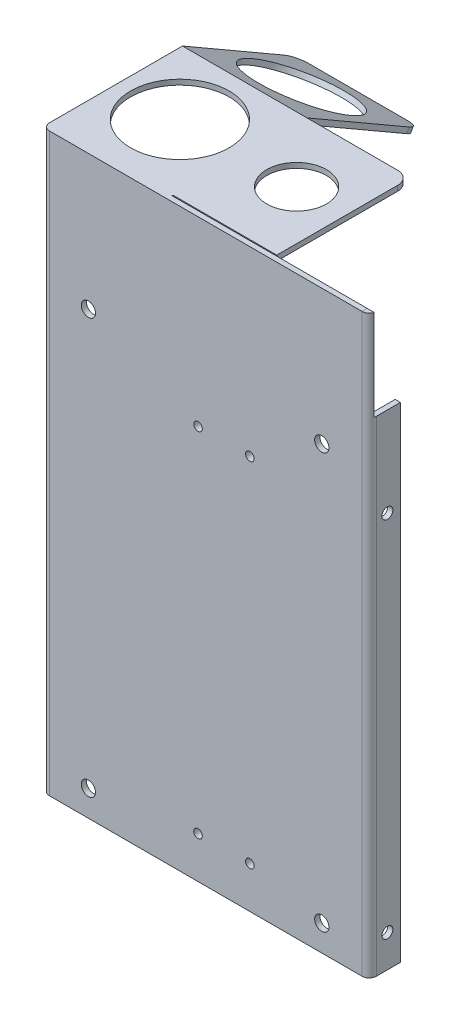
from build123d import *

# Parameters (mm, degrees)
SM_BASE_FLANGE_1_DEPTH = 111
CUT_EXTRUDE_1_REACH    = 170.348
SKETCH_3_W             = 10
SKETCH_3_H             = 35
EXTRUDE_1_DEPTH        = 4
M4X0_7_1_D             = 3.3
SKETCH_8_R             = 2.75
CUT_EXTRUDE_2_DEPTH    = 129.023435355
M5X0_8_1_AT_2_COUNT    = 2
M5X0_8_1_AT_2_PITCH    = 140
EXTRUDE_2_DEPTH        = 48
SKETCH_12_R            = 19
CUT_EXTRUDE_3_DEPTH    = 2
SKETCH_13_R            = 19
CUT_EXTRUDE_4_DEPTH    = 2
FILLET_1_R             = 5
SKETCH_14_W            = 51.6317
SKETCH_14_H            = 2
EXTRUDE_3_DEPTH        = 40
CUT_EXTRUDE_5_REACH    = 252.621
SKETCH_15_R            = 11.5
FILLET_2_R             = 5


# Sheet-metal steps are written as plain solids
with BuildPart() as part:
    # Sketch 1 → 基体-法兰1 (new, symmetric)
    with BuildSketch(Plane(origin=(0, 0, 0), x_dir=(1, 0, 0), z_dir=(0, 1, 0))):
        with BuildLine():
            Line((-63, 12), (-63, 2.7366))
            ThreePointArc((-63, 2.7366), (-62.198468417, 0.801531583), (-60.2634, 0))
            Line((-60.2634, 0), (60.2634, 0))
            ThreePointArc((60.2634, 0), (62.198468417, 0.801531583), (63, 2.7366))
            Line((63, 2.7366), (63, 12))
            Line((63, 12), (61, 12))
            Line((61, 12), (61, 2.7366))
            ThreePointArc((61, 2.7366), (60.784254855, 2.215745145), (60.2634, 2))
            Line((60.2634, 2), (-60.2634, 2))
            ThreePointArc((-60.2634, 2), (-60.784254855, 2.215745145), (-61, 2.7366))
            Line((-61, 2.7366), (-61, 12))
            Line((-61, 12), (-63, 12))
        make_face()
    extrude(amount=SM_BASE_FLANGE_1_DEPTH, both=True)

    # 草图3 → 切除-拉伸1 (cut, up to next)
    with BuildSketch(Plane(origin=(63, 0, 0), x_dir=(0, 0, -1), z_dir=(1, 0, 0)), mode=Mode.PRIVATE) as cut_extrude_1_sk1:
        with Locations((7, 93.5)):
            Rectangle(SKETCH_3_W, SKETCH_3_H)
    cut_extrude_1_tool1 = extrude(cut_extrude_1_sk1.sketch, amount=-CUT_EXTRUDE_1_REACH, mode=Mode.PRIVATE) & part.part
    add(cut_extrude_1_tool1.solids().sort_by_distance((63, 93.5, -7))[0], mode=Mode.SUBTRACT)

    # 草图4 → 凸台-拉伸1 (add)
    with BuildSketch(Plane(origin=(0, 0, -2), x_dir=(-1, 0, 0), z_dir=(0, 0, -1))):
        Polygon((-14.987954458, 43.07002562), (-17.786672003, 43.777495363), (-19.798717545, 41.707469743), (-19.012045542, 38.92997438), (-16.213327997, 38.222504637), (-14.201282455, 40.292530257), align=None)
        Polygon((5.723956961, 41.955715338), (3.534304719, 43.836873596), (0.810347758, 42.881158258), (0.276043039, 40.044284662), (2.465695281, 38.163126404), (5.189652242, 39.118841742), align=None)
        Polygon((-15.276915043, -92.683901651), (-18.14425753, -92.34971548), (-19.867342487, -94.665813829), (-18.723084957, -97.316098349), (-15.85574247, -97.65028452), (-14.132657513, -95.334186171), align=None)
        Polygon((5.052579277, -92.9701597), (2.268396373, -92.207494053), (0.215817096, -94.237334353), (0.947420723, -97.0298403), (3.731603627, -97.792505947), (5.784182904, -95.762665647), align=None)
    extrude(amount=EXTRUDE_1_DEPTH)

    # M4x0.7 螺纹孔1 (through all)
    with Locations(Plane(origin=(0, 0, -6), x_dir=(-1, 0, 0), z_dir=(0, 0, -1))):
        with Locations((-17, 41), (3, 41), (-17, -95), (3, -95)):
            Hole(M4X0_7_1_D / 2)

    # 草图8 → 切除-拉伸2 (cut, through all)
    with BuildSketch(Plane(origin=(0, 0, -2), x_dir=(-1, 0, 0), z_dir=(0, 0, -1))):
        with Locations((-44.723956961, 59)):
            Circle(SKETCH_8_R)
        with Locations(Location((45.276043039, 59, 0), (0, 0, 180))):
            Circle(SKETCH_8_R)
        with Locations((-44.723956961, -101)):
            Circle(SKETCH_8_R)
        with Locations(Location((45.276043039, -101, 0), (0, 0, 180))):
            Circle(SKETCH_8_R)
    extrude(amount=-CUT_EXTRUDE_2_DEPTH, mode=Mode.SUBTRACT)

    # 草图9 → M5x0.8 螺纹孔1 (revolve, cut)
    with BuildSketch(Plane(origin=(63, -98.5, -7), x_dir=(0, 0, -1), z_dir=(0, 1, 0))):
        Polygon((0, 0), (0, 13.6618073), (2.1, 12.4), (2.1, 0), align=None)
    m5x0_8_1 = revolve(axis=Axis((69.35, -98.5, -7), (-1, 0, 0)), mode=Mode.SUBTRACT)

    # M5x0.8 螺纹孔1 at 2: M5x0.8 螺纹孔1 ×2
    with Locations(*[(0, i * M5X0_8_1_AT_2_PITCH, 0) for i in range(1, M5X0_8_1_AT_2_COUNT)]):
        add(m5x0_8_1, mode=Mode.SUBTRACT)

    # 镜向1: M5x0.8 螺纹孔1 across plane
    add(m5x0_8_1.mirror(Plane(origin=(0, 0, 0), x_dir=(0, 0, 1), z_dir=(1, 0, 0))), mode=Mode.SUBTRACT)

    # 镜向1 copy 1 sketch → 镜向1 copy 1 (revolve, cut)
    with BuildSketch(Plane(origin=(-63, 41.5, -7), x_dir=(0, 0, -1), z_dir=(0, 1, 0))):
        Polygon((0, 0), (0, -13.6618073), (2.1, -12.4), (2.1, 0), align=None)
    revolve(axis=Axis((-69.35, 41.5, -7), (-1, 0, 0)), mode=Mode.SUBTRACT)

    # 草图11 → 凸台-拉伸2 (add)
    with BuildSketch(Plane.ZY.offset(63)):
        Polygon((-2, 111), (-54, 111), (-97.765371804, 85.732050808), (-96.765371804, 84), (-53.464101615, 109), (-2, 109), align=None)
    extrude(amount=-EXTRUDE_2_DEPTH)

    # 草图12 → 切除-拉伸3 (cut)
    with BuildSketch(Plane(origin=(0, 111, 0), x_dir=(1, 0, 0), z_dir=(0, 1, 0))):
        with Locations(Location((-39, 29, 0), (0, 0, 270))):
            Circle(SKETCH_12_R)
    extrude(amount=-CUT_EXTRUDE_3_DEPTH, mode=Mode.SUBTRACT)

    # 草图13 → 切除-拉伸4 (cut)
    with BuildSketch(Plane(origin=(0, 106.632685902, -61.56440991), x_dir=(1, 0, 0), z_dir=(0, 0.8660254037844386, -0.5000000000000001))):
        with Locations(Location((-39, 16.533320997, 0), (0, 0, 270))):
            Circle(SKETCH_13_R)
    extrude(amount=-CUT_EXTRUDE_4_DEPTH, mode=Mode.SUBTRACT)

    # 圆角1
    fillet_1_edges = [part.edges().sort_by_distance(p)[0] for p in [
        (-63, 84.866025404, -97.265371804),
        (-15, 84.866025404, -97.265371804),
    ]]
    fillet(fillet_1_edges, radius=FILLET_1_R)

    # 草图14 → 凸台-拉伸3 (add)
    with BuildSketch(Plane(origin=(-15, 0, 0), x_dir=(0, 0, -1), z_dir=(1, 0, 0))):
        with Locations((28.18415, 110)):
            Rectangle(SKETCH_14_W, SKETCH_14_H)
    extrude(amount=EXTRUDE_3_DEPTH)

    # 草图15 → 切除-拉伸5 (cut, up to next)
    with BuildSketch(Plane(origin=(0, 111, 0), x_dir=(1, 0, 0), z_dir=(0, 1, 0)), mode=Mode.PRIVATE) as cut_extrude_5_sk1:
        with Locations(Location((6, 29, 0), (0, 0, 270))):
            Circle(SKETCH_15_R)
    cut_extrude_5_tool1 = extrude(cut_extrude_5_sk1.sketch, amount=-CUT_EXTRUDE_5_REACH, mode=Mode.PRIVATE) & part.part
    add(cut_extrude_5_tool1.solids().sort_by_distance((6, 111, -29))[0], mode=Mode.SUBTRACT)

    # 圆角2
    fillet_2_edges = [part.edges().sort_by_distance(p)[0] for p in [
        (25, 110, -54),
    ]]
    fillet(fillet_2_edges, radius=FILLET_2_R)


solid = part.part
